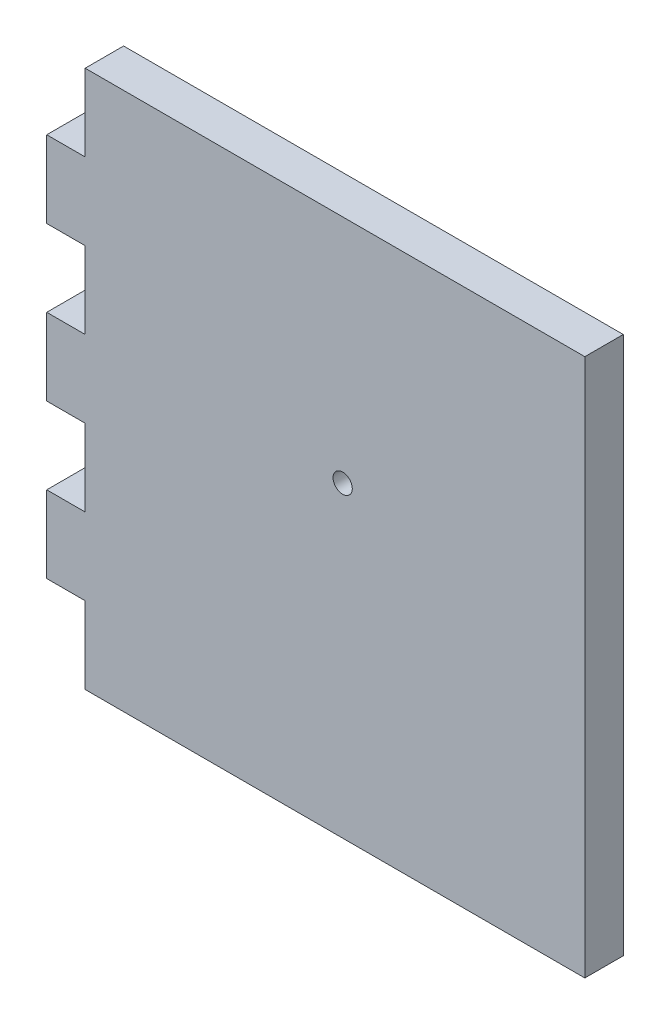
from build123d import *

# Parameters (mm, degrees)
SKETCH1_W           = 177.8
SKETCH1_H           = 177.8
BOSS_EXTRUDE1_DEPTH = 12.7
SKETCH2_R           = 3.175
CUT_EXTRUDE3_DEPTH  = 252.76769054
SKETCH4_W           = 12.7
SKETCH4_H           = 25.4
CUT_EXTRUDE4_DEPTH  = 252.76769054


with BuildPart() as part:
    # Sketch1 → Boss-Extrude1 (new body)
    with BuildSketch(Plane.XY):
        with Locations((88.9, -88.9)):
            Rectangle(SKETCH1_W, SKETCH1_H)
    extrude(amount=BOSS_EXTRUDE1_DEPTH)

    # Sketch2 → Cut-Extrude3 (cut, through all)
    with BuildSketch(Plane.XY.offset(12.7)):
        with Locations((97.79, -76.2)):
            Circle(SKETCH2_R)
    extrude(amount=-CUT_EXTRUDE3_DEPTH, mode=Mode.SUBTRACT)

    # Sketch4 → Cut-Extrude4 (cut, through all)
    with BuildSketch(Plane.XY.offset(12.7)):
        with Locations((6.35, -12.7)):
            Rectangle(SKETCH4_W, SKETCH4_H)
        with Locations((6.35, -63.5)):
            Rectangle(SKETCH4_W, SKETCH4_H)
        with Locations((6.35, -114.3)):
            Rectangle(SKETCH4_W, SKETCH4_H)
        with Locations((6.35, -165.1)):
            Rectangle(SKETCH4_W, SKETCH4_H)
    extrude(amount=-CUT_EXTRUDE4_DEPTH, mode=Mode.SUBTRACT)


solid = part.part
